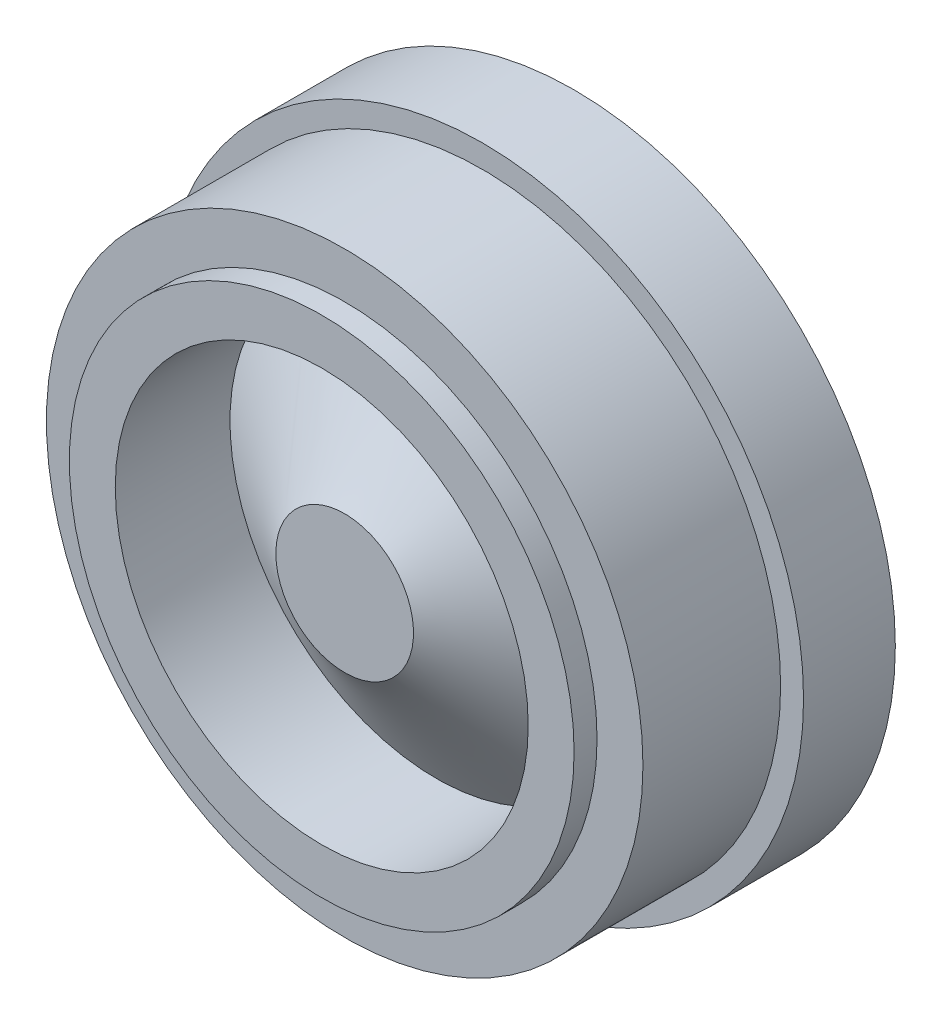
from build123d import *

# Parameters (mm, degrees)
SKETCH1_R           = 14
BOSS_EXTRUDE1_DEPTH = 11
CUT_EXTRUDE1_START  = -7
SKETCH2_R           = 14
SKETCH2_R_2         = 13
CUT_EXTRUDE1_DEPTH  = 7
CUT_EXTRUDE2_START  = -1
SKETCH3_R           = 13
SKETCH3_R_2         = 11
CUT_EXTRUDE2_DEPTH  = 1
SKETCH4_R           = 9
CUT_EXTRUDE3_DEPTH  = 5
SKETCH5_R           = 5
CUT_EXTRUDE4_DEPTH  = 5


with BuildPart() as part:
    # Sketch1 → Boss-Extrude1 (new body)
    with BuildSketch(Plane.XY):
        Circle(SKETCH1_R)
    extrude(amount=BOSS_EXTRUDE1_DEPTH)

    # Sketch2 → Cut-Extrude1 (cut)
    with BuildSketch(Plane.XY.offset(11).offset(CUT_EXTRUDE1_START)):
        Circle(SKETCH2_R)
        Circle(SKETCH2_R_2, mode=Mode.SUBTRACT)
    extrude(amount=CUT_EXTRUDE1_DEPTH, mode=Mode.SUBTRACT)

    # Sketch3 → Cut-Extrude2 (cut)
    with BuildSketch(Plane.XY.offset(11).offset(CUT_EXTRUDE2_START)):
        Circle(SKETCH3_R)
        Circle(SKETCH3_R_2, mode=Mode.SUBTRACT)
    extrude(amount=CUT_EXTRUDE2_DEPTH, mode=Mode.SUBTRACT)

    # Sketch4 → Cut-Extrude3 (cut)
    with BuildSketch(Plane.XY.offset(11)):
        Circle(SKETCH4_R)
    extrude(amount=-CUT_EXTRUDE3_DEPTH, mode=Mode.SUBTRACT)

    # Sketch5 → Cut-Extrude4 (cut)
    with BuildSketch(Plane(origin=(0, 0, 0), x_dir=(-1, 0, 0), z_dir=(0, 0, -1))):
        Circle(SKETCH5_R)
    extrude(amount=-CUT_EXTRUDE4_DEPTH, mode=Mode.SUBTRACT)

    # Loft1: read off the stored shape, not the designer's step
    # Loft1: loft between two sections, ruled curve by curve
    loft1_from = [
        Edge.make_bspline([(-2.631639621, 1.44030306, 10), (0.248966499, 6.703582302, 10), (5.512245741, 3.822976182, 10), (2.631639621, -1.44030306, 10), (-0.248966499, -6.703582302, 10), (-5.512245741, -3.822976182, 10), (-2.631639621, 1.44030306, 10)], [0, 0, 0, 0, 0.5, 0.5, 0.5, 1, 1, 1, 1], 3, [1, 0.333333333, 0.333333333, 1, 0.333333333, 0.333333333, 1]),
    ]
    loft1_to = [
        Edge.make_bspline([(-5.534018928, 7.097509035, 6), (8.660999143, 18.165546891, 6), (19.729036998, 3.97052882, 6), (5.534018928, -7.097509035, 6), (-8.660999143, -18.165546891, 6), (-19.729036998, -3.97052882, 6), (-5.534018928, 7.097509035, 6)], [0, 0, 0, 0, 0.5, 0.5, 0.5, 1, 1, 1, 1], 3, [1, 0.333333333, 0.333333333, 1, 0.333333333, 0.333333333, 1]),
    ]
    loft1 = Solid(Shell([*[Face.make_surface_from_curves(loft1_from[k], loft1_to[k]) for k in range(1)], Face(Wire(loft1_from)), Face(Wire(loft1_to))]))
    add(loft1)


solid = part.part
